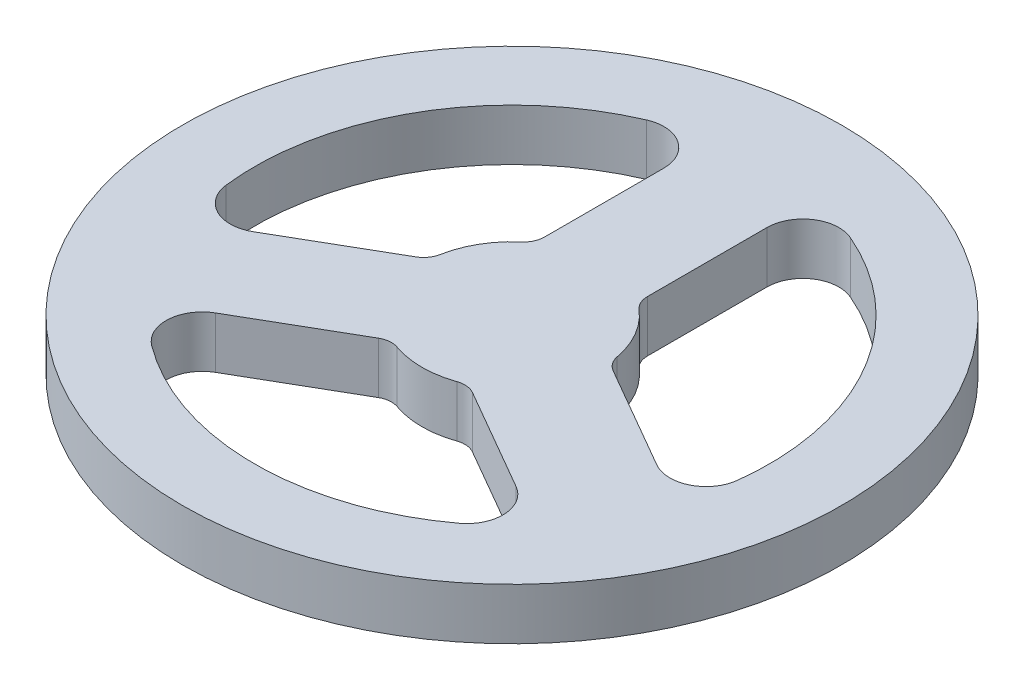
from build123d import *

# Parameters (mm, degrees)
SZKIC1_R                    = 64
DODANIE_WYCI_GNI_CIE1_DEPTH = 10
ZAOKR_GLENIE1_R             = 7
ZAOKR_GLENIE2_R             = 4


with BuildPart() as part:
    # Szkic1 → Dodanie-wyciągnięcie1 (new body)
    with BuildSketch(Plane(origin=(0, 0, 0), x_dir=(1, 0, 0), z_dir=(0, 1, 0))):
        Circle(SZKIC1_R)
        with BuildLine():
            ThreePointArc((17.437342964, 1.47955073), (15.155444566, 8.75), (10, 14.361406616))
            Line((10, 14.361406616), (10, 48.989794856))
            ThreePointArc((10, 48.989794856), (43.301270189, 25), (47.426406871, -15.83464339))
            Line((47.426406871, -15.83464339), (17.437342964, 1.47955073))
        make_face(mode=Mode.SUBTRACT)
        with BuildLine():
            ThreePointArc((-7.437342964, -15.840957346), (0, -17.5), (7.437342964, -15.840957346))
            Line((7.437342964, -15.840957346), (37.426406871, -33.155151466))
            ThreePointArc((37.426406871, -33.155151466), (0, -50), (-37.426406871, -33.155151466))
            Line((-37.426406871, -33.155151466), (-7.437342964, -15.840957346))
        make_face(mode=Mode.SUBTRACT)
        with BuildLine():
            ThreePointArc((-10, 14.361406616), (-15.155444566, 8.75), (-17.437342964, 1.47955073))
            Line((-17.437342964, 1.47955073), (-47.426406871, -15.83464339))
            ThreePointArc((-47.426406871, -15.83464339), (-43.301270189, 25), (-10, 48.989794856))
            Line((-10, 48.989794856), (-10, 14.361406616))
        make_face(mode=Mode.SUBTRACT)
    extrude(amount=DODANIE_WYCI_GNI_CIE1_DEPTH)

    # Zaokrąglenie1
    zaokr_glenie1_edges = [part.edges().sort_by_distance(p)[0] for p in [
        (10, 5, -48.989794856),
        (37.426406871, 5, 33.155151466),
        (-10, 5, -48.989794856),
        (47.426406871, 5, 15.83464339),
        (-47.426406871, 5, 15.83464339),
        (-37.426406871, 5, 33.155151466),
    ]]
    fillet(zaokr_glenie1_edges, radius=ZAOKR_GLENIE1_R)

    # Zaokrąglenie2
    zaokr_glenie2_edges = [part.edges().sort_by_distance(p)[0] for p in [
        (17.437342964, 5, -1.47955073),
        (10, 5, -14.361406616),
        (-7.437342964, 5, 15.840957346),
        (7.437342964, 5, 15.840957346),
        (-17.437342964, 5, -1.47955073),
        (-10, 5, -14.361406616),
    ]]
    fillet(zaokr_glenie2_edges, radius=ZAOKR_GLENIE2_R)


solid = part.part
